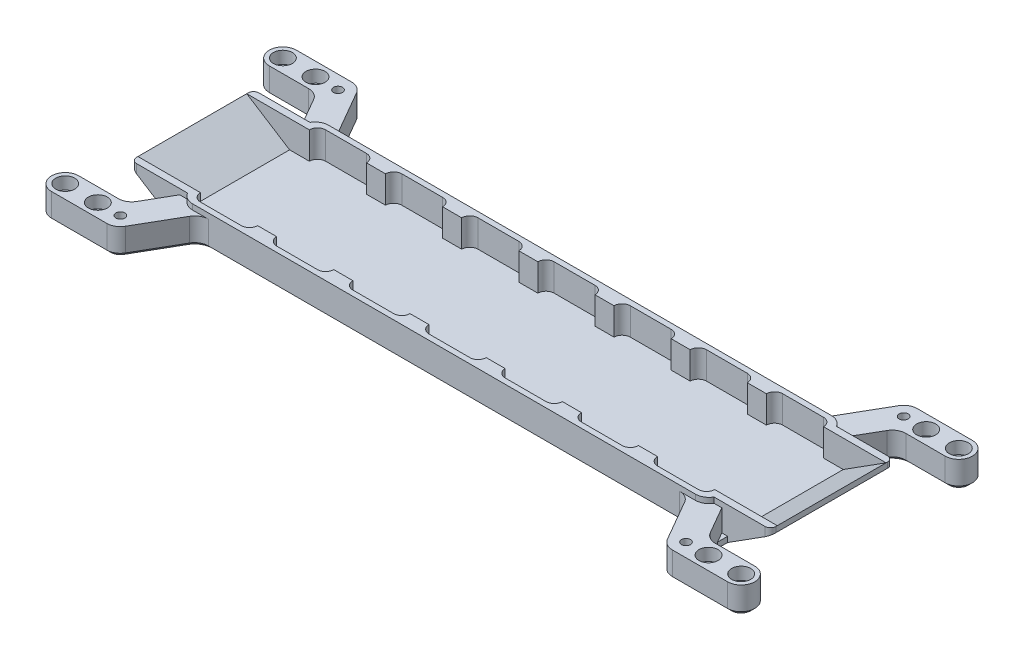
from build123d import *

# Parameters (mm, degrees)
SKETCH_1_R                 = 1.65
EXTRUDE_1_DEPTH            = 12
FILLET_1_R                 = 5
SKETCH_3_R                 = 2.75
SKETCH_3_R_2               = 3
CUT_EXTRUDE_1_DEPTH        = 3
SKETCH_4_W                 = 353.760068279
SKETCH_4_H                 = 71.916373997
CUT_EXTRUDE_2_DEPTH        = 2
FILLET_2_R                 = 5
CUT_EXTRUDE_3_DEPTH        = 10
PATTERN_LINEAR_1_COUNT     = 4
PATTERN_LINEAR_1_PITCH     = 28
PATTERN_LINEAR_1_COL_COUNT = 4
PATTERN_LINEAR_1_COL_PITCH = 28
SKETCH_6_R                 = 3.5
CUT_EXTRUDE_4_DEPTH        = 4.5
SKETCH_7_R                 = 1.6
CUT_EXTRUDE_5_DEPTH        = 10
EXTRUDE_2_DEPTH            = 2
CUT_EXTRUDE_6_REACH        = 261.112
EXTRUDE_3_DEPTH            = 2.5
EXTRUDE_4_DEPTH            = 20
CUT_EXTRUDE_START          = -10
CUT_EXTRUDE_7_OUTLINE_R    = 1.65
CUT_EXTRUDE_7_DEPTH        = 10
FILLET_4_R                 = 2
CHAMFER_1_SIZE             = 1.5


# Read off the part's stored shape, not the designer's step: 切除-拉伸7
with BuildPart() as part:
    # 草图1 → 凸台-拉伸1 (new body)
    with BuildSketch(Plane(origin=(0, 0, 0), x_dir=(1, 0, 0), z_dir=(0, 1, 0))):
        with BuildLine():
            Line((14.275, 5), (-14.275, 5))
            ThreePointArc((-14.275, 5), (-19.275, 0), (-14.275, -5))
            Line((-14.275, -5), (11.388248654, -5))
            Line((11.388248654, -5), (21.491878365, -22.5))
            ThreePointArc((21.491878365, -22.5), (23.322005384, -24.330127019), (25.822005384, -25))
            Line((25.822005384, -25), (210.627994616, -25))
            ThreePointArc((210.627994616, -25), (213.127994616, -24.330127019), (214.958121635, -22.5))
            Line((214.958121635, -22.5), (225.061751346, -5))
            Line((225.061751346, -5), (250.725, -5))
            ThreePointArc((250.725, -5), (255.725, 0), (250.725, 5))
            Line((250.725, 5), (222.175, 5))
            ThreePointArc((222.175, 5), (219.675, 4.330127019), (217.844872981, 2.5))
            Line((217.844872981, 2.5), (207.74124327, -15))
            Line((207.74124327, -15), (28.70875673, -15))
            Line((28.70875673, -15), (18.605127019, 2.5))
            ThreePointArc((18.605127019, 2.5), (16.775, 4.330127019), (14.275, 5))
        make_face()
        with Locations(Location((-14.275, 0, 0), (0, 0, 270))):
            Circle(SKETCH_1_R, mode=Mode.SUBTRACT)
        with Locations(Location((14.275, 0, 0), (0, 0, 270))):
            Circle(SKETCH_1_R, mode=Mode.SUBTRACT)
        with Locations(Location((222.175, 0, 0), (0, 0, 270))):
            Circle(SKETCH_1_R, mode=Mode.SUBTRACT)
        with Locations(Location((250.725, 0, 0), (0, 0, 270))):
            Circle(SKETCH_1_R, mode=Mode.SUBTRACT)
    extrude(amount=EXTRUDE_1_DEPTH)

    # 圆角1
    fillet_1_edges = [part.edges().sort_by_distance(p)[0] for p in [
        (225.061751346, 6, 5),
        (11.388248654, 6, 5),
        (28.70875673, 6, 15),
        (207.74124327, 6, 15),
    ]]
    fillet(fillet_1_edges, radius=FILLET_1_R)

    # 草图3 → 切除-拉伸1 (cut)
    with BuildSketch(Plane(origin=(0, 0, 0), x_dir=(1, 0, 0), z_dir=(0, 1, 0))):
        with Locations(Location((-14.275, 0, 0), (0, 0, 270))):
            Circle(SKETCH_3_R)
        with Locations(Location((14.275, 0, 0), (0, 0, 270))):
            Circle(SKETCH_3_R_2)
        with Locations(Location((250.725, 0, 0), (0, 0, 270))):
            Circle(SKETCH_3_R)
        with Locations(Location((222.175, 0, 0), (0, 0, 270))):
            Circle(SKETCH_3_R_2)
    extrude(amount=CUT_EXTRUDE_1_DEPTH, mode=Mode.SUBTRACT)

    # 草图4 → 切除-拉伸2 (cut)
    with BuildSketch(Plane(origin=(0, 12, 0), x_dir=(1, 0, 0), z_dir=(0, 1, 0))):
        with Locations((127.300161481, 20.958186999)):
            Rectangle(SKETCH_4_W, SKETCH_4_H)
    extrude(amount=-CUT_EXTRUDE_2_DEPTH, mode=Mode.SUBTRACT)

    # 圆角2
    fillet_2_edges = [part.edges().sort_by_distance(p)[0] for p in [
        (17.161751346, 11, 15),
        (219.288248654, 11, 15),
    ]]
    fillet(fillet_2_edges, radius=FILLET_2_R - 0.0001)  # a hair under: the kernel refuses the full size

    # 草图5 → 切除-拉伸3 (cut)
    with BuildSketch(Plane(origin=(0, 12, 0), x_dir=(1, 0, 0), z_dir=(0, 1, 0))):
        with BuildLine():
            Line((110.725, -17), (125.725, -17))
            ThreePointArc((125.725, -17), (128.725, -20), (125.725, -23))
            Line((125.725, -23), (110.725, -23))
            ThreePointArc((110.725, -23), (107.725, -20), (110.725, -17))
        make_face()
    cut_extrude_3 = extrude(amount=-CUT_EXTRUDE_3_DEPTH, mode=Mode.SUBTRACT)

    # 阵列(线性)1: 切除-拉伸3 ×4
    with Locations(*[(i * PATTERN_LINEAR_1_PITCH, 0, 0) for i in range(1, PATTERN_LINEAR_1_COUNT)]):
        add(cut_extrude_3, mode=Mode.SUBTRACT)

    # 阵列(线性)1 col: 切除-拉伸3 ×4
    with Locations(*[(-i * PATTERN_LINEAR_1_COL_PITCH, 0, 0) for i in range(1, PATTERN_LINEAR_1_COL_COUNT)]):
        add(cut_extrude_3, mode=Mode.SUBTRACT)

    # 草图6 → 切除-拉伸4 (cut)
    with BuildSketch(Plane(origin=(0, 10, 0), x_dir=(1, 0, 0), z_dir=(0, 1, 0))):
        with Locations(Location((-6, 0, 0), (0, 0, 270))):
            Circle(SKETCH_6_R)
        with Locations(Location((6, 0, 0), (0, 0, 270))):
            Circle(SKETCH_6_R)
        with Locations(Location((230.455, 0, 0), (0, 0, 270))):
            Circle(SKETCH_6_R)
        with Locations(Location((242.445, 0, 0), (0, 0, 270))):
            Circle(SKETCH_6_R)
    extrude(amount=-CUT_EXTRUDE_4_DEPTH, mode=Mode.SUBTRACT)

    # 草图7 → 切除-拉伸5 (cut)
    with BuildSketch(Plane(origin=(0, 5.5, 0), x_dir=(1, 0, 0), z_dir=(0, 1, 0))):
        with Locations(Location((-6, 0, 0), (0, 0, 270))):
            Circle(SKETCH_7_R)
        with Locations(Location((6, 0, 0), (0, 0, 270))):
            Circle(SKETCH_7_R)
        with Locations(Location((230.455, 0, 0), (0, 0, 270))):
            Circle(SKETCH_7_R)
        with Locations(Location((242.445, 0, 0), (0, 0, 270))):
            Circle(SKETCH_7_R)
    extrude(amount=-CUT_EXTRUDE_5_DEPTH, mode=Mode.SUBTRACT)

    # 草图8 → 凸台-拉伸2 (add)
    with BuildSketch(Plane(origin=(0, 0, 0), x_dir=(-1, 0, 0), z_dir=(0, -1, 0))):
        Polygon((-16.475, -13.810511777), (-16.475, -40), (-219.975, -40), (-219.975, -13.810511777), (-216.401497308, -20), (-20.048502692, -20), align=None)
    extrude(amount=-EXTRUDE_2_DEPTH)

    # 切除-拉伸6: up to this face of the body (flat: up to its plane)
    cut_extrude_6_end = Plane(part.part.faces().sort_by_distance((118.225, 2, 32.233543306))[0])
    # 草图9 → 切除-拉伸6 (cut, up to the picked face)
    with BuildSketch(Plane(origin=(0, 12, 0), x_dir=(1, 0, 0), z_dir=(0, 1, 0)), mode=Mode.PRIVATE) as cut_extrude_6_sk1:
        Polygon((26.725, -20), (209.725, -20), (219.975, -20), (219.975, -40), (16.475, -40), (16.475, -20), align=None)
    cut_extrude_6_tool1 = split(extrude(cut_extrude_6_sk1.sketch, amount=-CUT_EXTRUDE_6_REACH, mode=Mode.PRIVATE), bisect_by=cut_extrude_6_end, keep=Keep.BOTH, mode=Mode.PRIVATE)
    add(cut_extrude_6_tool1.solids().sort_by(Axis((118.225, 12, 30), (0, -1, 0)))[0], mode=Mode.SUBTRACT)

    # 草图11 → 凸台-拉伸3 (add)
    with BuildSketch(Plane.XY.offset(20)):
        Polygon((16.475, 12), (0.725, 12), (0.725, 10), (16.475, 0), (23.725, 0), (23.725, 12), align=None)
    extrude_3 = extrude(amount=-EXTRUDE_3_DEPTH)

    # 草图12 → 凸台-拉伸4 (add)
    with BuildSketch(Plane.XY.offset(20)):
        Polygon((16.475, 2), (0.725, 12), (0.725, 10), (16.475, 0), align=None)
    extrude_4 = extrude(amount=EXTRUDE_4_DEPTH)

    # 镜向2: 凸台-拉伸3, 凸台-拉伸4 across plane
    add(extrude_3.mirror(Plane.ZY.offset(-118.225)))
    add(extrude_4.mirror(Plane.ZY.offset(-118.225)))

    # 镜向1: part across face


with BuildPart() as part_1:
    add(part.part)
    add(part.part.mirror(Plane(origin=(118.225, 1.670212766, 40), x_dir=(1, 0, 0), z_dir=(0, 0, 1))))

    # 切除-拉伸7 outline → 切除-拉伸7 (cut)
    # profile 1 of 4: a face of its own
    with BuildSketch(Plane(origin=(0, 0, 0), x_dir=(-1, 0, 0), z_dir=(0, -1, 0)).offset(CUT_EXTRUDE_START)):
        with BuildLine():
            ThreePointArc((-242.445, -85), (-247.445, -80), (-242.445, -75))
            Line((-242.445, -75), (-250.725, -75))
            ThreePointArc((-250.725, -75), (-255.725, -80), (-250.725, -85))
            Line((-250.725, -85), (-242.445, -85))
        make_face()
        with Locations((-250.725, -80)):
            Circle(CUT_EXTRUDE_7_OUTLINE_R, mode=Mode.SUBTRACT)
    # profile 2 of 4: a face of its own
    with BuildSketch(Plane(origin=(0, 0, 0), x_dir=(-1, 0, 0), z_dir=(0, -1, 0)).offset(CUT_EXTRUDE_START)):
        with BuildLine():
            ThreePointArc((6, -75), (11, -80), (6, -85))
            Line((6, -85), (14.275, -85))
            ThreePointArc((14.275, -85), (19.275, -80), (14.275, -75))
            Line((14.275, -75), (6, -75))
        make_face()
        with Locations((14.275, -80)):
            Circle(CUT_EXTRUDE_7_OUTLINE_R, mode=Mode.SUBTRACT)
    # profile 3 of 4: a face of its own
    with BuildSketch(Plane(origin=(0, 0, 0), x_dir=(-1, 0, 0), z_dir=(0, -1, 0)).offset(CUT_EXTRUDE_START)):
        with BuildLine():
            ThreePointArc((-242.445, -5), (-247.445, 0), (-242.445, 5))
            Line((-242.445, 5), (-250.725, 5))
            ThreePointArc((-250.725, 5), (-255.725, 0), (-250.725, -5))
            Line((-250.725, -5), (-242.445, -5))
        make_face()
        with Locations((-250.725, 0)):
            Circle(CUT_EXTRUDE_7_OUTLINE_R, mode=Mode.SUBTRACT)
    # profile 4 of 4: a face of its own
    with BuildSketch(Plane(origin=(0, 0, 0), x_dir=(-1, 0, 0), z_dir=(0, -1, 0)).offset(CUT_EXTRUDE_START)):
        with BuildLine():
            ThreePointArc((6, 5), (11, 0), (6, -5))
            Line((6, -5), (14.275, -5))
            ThreePointArc((14.275, -5), (19.275, 0), (14.275, 5))
            Line((14.275, 5), (6, 5))
        make_face()
        with Locations((14.275, 0)):
            Circle(CUT_EXTRUDE_7_OUTLINE_R, mode=Mode.SUBTRACT)
    extrude(amount=CUT_EXTRUDE_7_DEPTH, mode=Mode.SUBTRACT)

    # 圆角4
    fillet_4_edges = [part_1.edges().sort_by_distance(p)[0] for p in [
        (0.725, 11, 17.5),
        (235.725, 11, 17.5),
        (0.725, 11, 62.5),
        (235.725, 11, 62.5),
    ]]
    fillet(fillet_4_edges, radius=FILLET_4_R)

    # 倒角1
    chamfer_1_edges = [part_1.edges().sort_by_distance(p)[0] for p in [
        (16.775, 0, -4.330127019),
        (22.935254038, 0, 5),
        (219.675, 0, -4.330127019),
        (232.31, 0, -5),
        (221.796687836, 0, 10.655255888),
        (118.225, 0, 15),
        (232.31, 0, 85),
        (213.514745962, 0, 75),
        (118.225, 0, 65),
        (22.935254038, 0, 75),
        (221.796687836, 0, 69.344744112),
        (235.196751346, 0, 75),
        (219.675, 0, 84.330127019),
        (16.775, 0, 84.330127019),
        (14.653312164, 0, 69.344744112),
        (207.354491924, 0, 65.669872981),
        (29.095508076, 0, 65.669872981),
        (225.448502692, 0, 74.330127019),
        (11.001497308, 0, 74.330127019),
        (213.514745962, 0, 5),
        (235.196751346, 0, 5),
        (14.653312164, 0, 10.655255888),
        (207.354491924, 0, 14.330127019),
        (29.095508076, 0, 14.330127019),
        (225.448502692, 0, 5.669872981),
        (11.001497308, 0, 5.669872981),
        (1.250748654, 0, 75),
        (4.1375, 0, 85),
        (1.250748654, 0, 5),
        (4.1375, 0, -5),
        (-11, 0, 80),
        (247.445, 0, 80),
        (247.445, 0, 0),
        (-11, 0, 0),
    ]]
    chamfer(chamfer_1_edges, length=CHAMFER_1_SIZE)


solid = part_1.part
